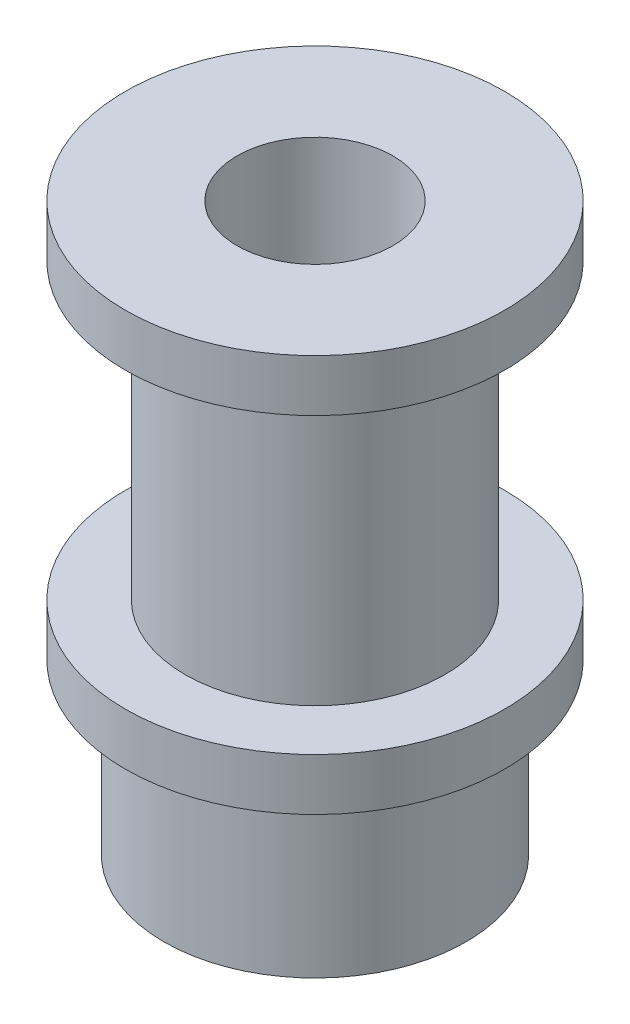
from build123d import *

# Parameters (mm, degrees)
SKETCH1_R           = 5
BOSS_EXTRUDE1_DEPTH = 11.3
SKETCH2_R           = 7.3
BOSS_EXTRUDE2_DEPTH = 2
BOSS_EXTRUDE3_START = 2
SKETCH3_R           = 7.3
BOSS_EXTRUDE3_DEPTH = 2
SKETCH4_R           = 3
CUT_EXTRUDE1_DEPTH  = 19.457247899
BOSS_EXTRUDE4_START = 6.5
SKETCH5_R           = 5.81652907
SKETCH5_R_2         = 3
BOSS_EXTRUDE4_DEPTH = 6.5


with BuildPart() as part:
    # Sketch1 → Boss-Extrude1 (new body)
    with BuildSketch(Plane(origin=(0, 0, 0), x_dir=(1, 0, 0), z_dir=(0, 1, 0))):
        Circle(SKETCH1_R)
    extrude(amount=BOSS_EXTRUDE1_DEPTH)

    # Sketch2 → Boss-Extrude2 (add)
    with BuildSketch(Plane(origin=(0, 11.3, 0), x_dir=(1, 0, 0), z_dir=(0, 1, 0))):
        Circle(SKETCH2_R)
    extrude(amount=BOSS_EXTRUDE2_DEPTH)

    # Sketch3 → Boss-Extrude3 (add)
    with BuildSketch(Plane.XZ.offset(BOSS_EXTRUDE3_START)):
        Circle(SKETCH3_R)
    extrude(amount=-BOSS_EXTRUDE3_DEPTH)

    # Sketch4 → Cut-Extrude1 (cut, through all)
    with BuildSketch(Plane.XZ.offset(2)):
        Circle(SKETCH4_R)
    extrude(amount=-CUT_EXTRUDE1_DEPTH, mode=Mode.SUBTRACT)

    # Sketch5 → Boss-Extrude4 (add)
    with BuildSketch(Plane.XZ.offset(2).offset(BOSS_EXTRUDE4_START)):
        Circle(SKETCH5_R)
        Circle(SKETCH5_R_2, mode=Mode.SUBTRACT)
    extrude(amount=-BOSS_EXTRUDE4_DEPTH)


solid = part.part
